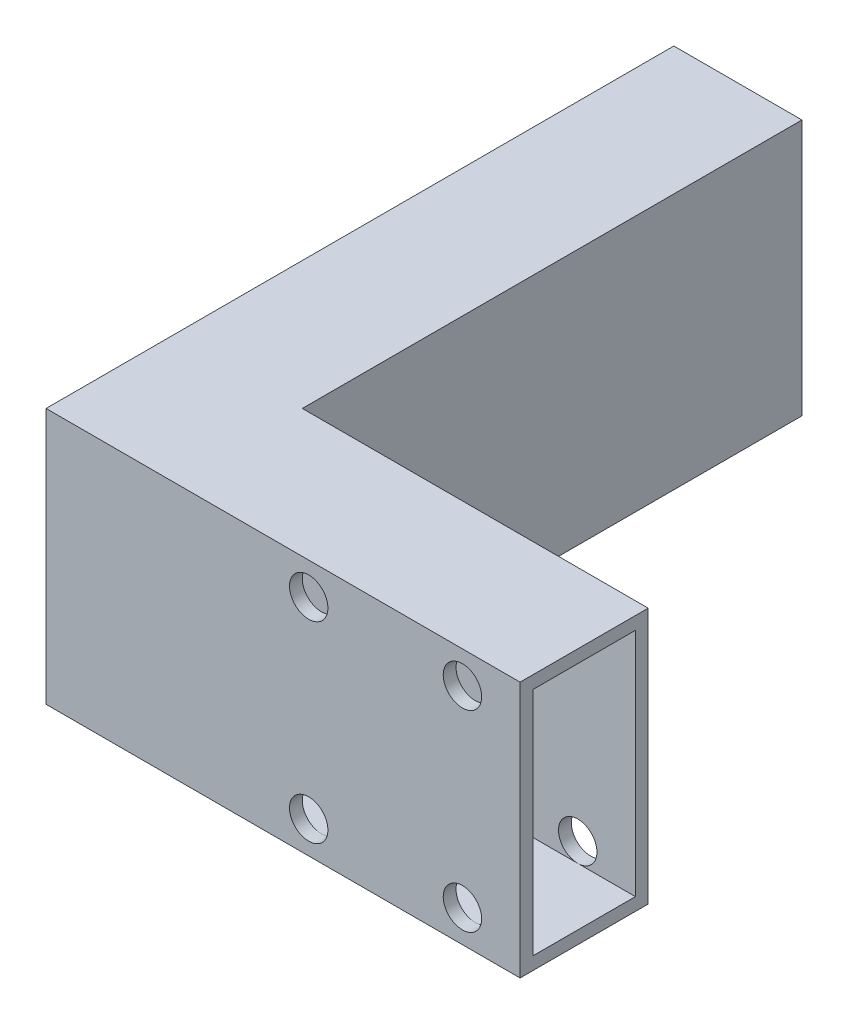
from build123d import *
from build123d.topology import SkipClean

# Parameters (mm, degrees)
EXTRUDE_1_DEPTH     = 20
MM_PRESS_1_D        = 3
SKETCH_4_W          = 8
SKETCH_4_H          = 18
CUT_EXTRUDE_1_DEPTH = 34
SKETCH_5_W          = 8
SKETCH_5_H          = 18
CUT_EXTRUDE_3_DEPTH = 36
SKETCH_7_W          = 10
SKETCH_7_H          = 20
SKETCH_7_W_2        = 8
SKETCH_7_H_2        = 18
EXTRUDE_2_DEPTH     = 14


with BuildPart() as part:
    # 草图1 → 凸台-拉伸1 (new body)
    with BuildSketch(Plane(origin=(0, 0, 0), x_dir=(1, 0, 0), z_dir=(0, 1, 0))):
        Polygon((0, 0), (0, 35), (10, 35), (10, 10), (37, 10), (37, 0), align=None)
    extrude(amount=EXTRUDE_1_DEPTH)

    # 大小mm Press 暗销孔1 (through all)
    with Locations(Plane(origin=(20.5, 2.5, -10), x_dir=(-1, 0, 0), z_dir=(0, 0, -1))):
        with Locations((0, 0), (-12, 0), (-12, 15), (0, 15)):
            Hole(MM_PRESS_1_D / 2)

    # 草图4 → 切除-拉伸1 (cut)
    with BuildSketch(Plane(origin=(0, 0, -35), x_dir=(-1, 0, 0), z_dir=(0, 0, -1))):
        with Locations((-5, 10)):
            Rectangle(SKETCH_4_W, SKETCH_4_H)
    extrude(amount=-CUT_EXTRUDE_1_DEPTH, mode=Mode.SUBTRACT)

    # 草图5 → 切除-拉伸3 (cut)
    with SkipClean():  # the faces are left unmerged after this step: merging them gives an invalid solid
        with BuildSketch(Plane(origin=(37, 0, 0), x_dir=(0, 0, -1), z_dir=(1, 0, 0))):
            with Locations((5, 10)):
                Rectangle(SKETCH_5_W, SKETCH_5_H)
        extrude(amount=-CUT_EXTRUDE_3_DEPTH, mode=Mode.SUBTRACT)

    # 草图7 → 凸台-拉伸2 (add)
    with SkipClean():  # the faces are left unmerged after this step: merging them gives an invalid solid
        with BuildSketch(Plane(origin=(0, 0, -35), x_dir=(-1, 0, 0), z_dir=(0, 0, -1))):
            with Locations((-5, 10)):
                Rectangle(SKETCH_7_W, SKETCH_7_H)
            with Locations((-5, 10)):
                Rectangle(SKETCH_7_W_2, SKETCH_7_H_2, mode=Mode.SUBTRACT)
        extrude(amount=EXTRUDE_2_DEPTH)


solid = part.part
